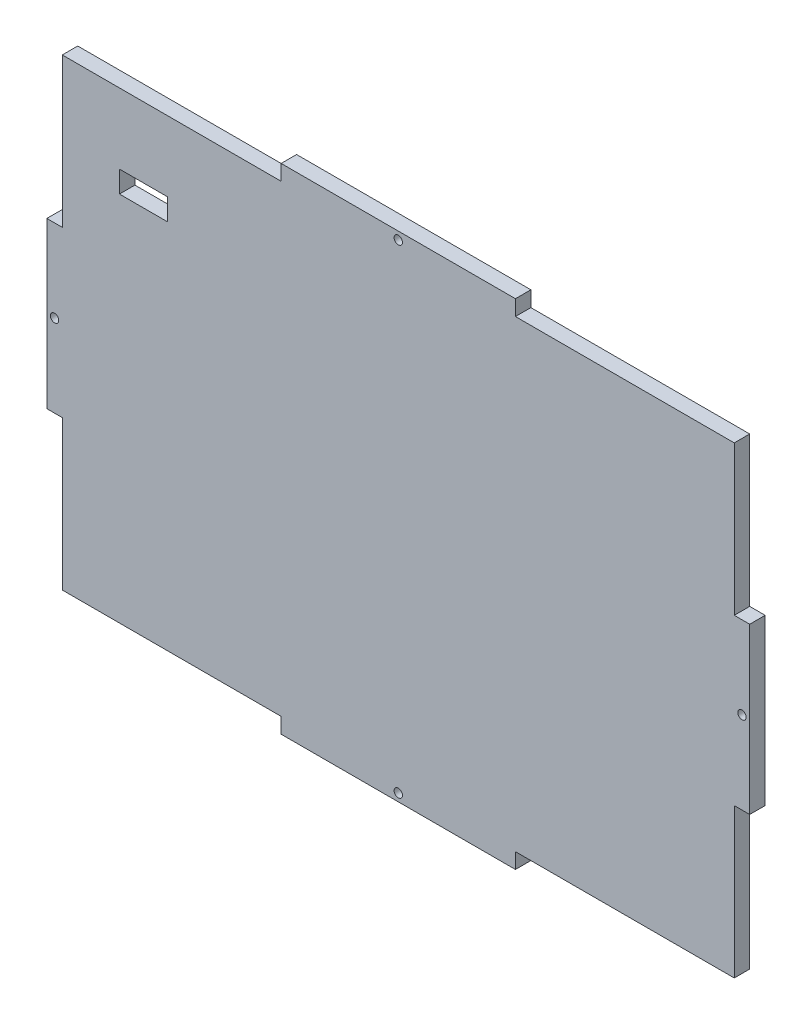
from build123d import *

# Parameters (mm, degrees)
SKETCH1_W           = 231.14
SKETCH1_H           = 162.56
BOSS_EXTRUDE1_DEPTH = 5.08
SKETCH2_R           = 1.37795
CUT_EXTRUDE1_DEPTH  = 142.381291902
CAVITY2_START       = -81.28
CAVITY2_OUTLINE_W   = 77.046666667
CAVITY2_OUTLINE_H   = 5.08
CAVITY2_DEPTH       = 5.08
CAVITY2_START_2     = 76.2
CAVITY2_2_OUTLINE_W = 77.046666667
CAVITY2_2_OUTLINE_H = 5.08
CAVITY2_2_DEPTH     = 5.08
CAVITY2_START_3     = -76.2
CAVITY2_3_OUTLINE_W = 5.08
CAVITY2_3_OUTLINE_H = 5.08
CAVITY2_3_DEPTH     = 49.106666667
CAVITY2_START_4     = 27.093333333
CAVITY2_4_OUTLINE_W = 5.08
CAVITY2_4_OUTLINE_H = 5.08
CAVITY2_4_DEPTH     = 49.106666667
SKETCH3_W           = 15.748
SKETCH3_H           = 7.112
CUT_EXTRUDE2_DEPTH  = 142.381291902


# Read off the part's stored shape, not the designer's step: Cavity2
with BuildPart() as part:
    # Sketch1 → Boss-Extrude1 (new body)
    with BuildSketch(Plane.XY):
        Rectangle(SKETCH1_W, SKETCH1_H)
    extrude(amount=BOSS_EXTRUDE1_DEPTH)

    # Sketch2 → Cut-Extrude1 (cut, through all)
    with BuildSketch(Plane(origin=(0, 0, 0), x_dir=(-1, 0, 0), z_dir=(0, 0, -1))):
        with Locations((-113.03, 0)):
            Circle(SKETCH2_R)
        with Locations(Location((0, 78.74, 0), (0, 0, 180))):
            Circle(SKETCH2_R)
        with Locations(Location((113.03, 0, 0), (0, 0, 180))):
            Circle(SKETCH2_R)
        with Locations((0, -78.74)):
            Circle(SKETCH2_R)
    extrude(amount=-CUT_EXTRUDE1_DEPTH, mode=Mode.SUBTRACT)

    # Cavity2 outline → Cavity2 (cut)
    with BuildSketch(Plane(origin=(0, 0, 0), x_dir=(1, 0, 0), z_dir=(0, 1, 0)).offset(CAVITY2_START)):
        with Locations((-77.046666667, -2.54)):
            Rectangle(CAVITY2_OUTLINE_W, CAVITY2_OUTLINE_H)
        with Locations((77.046666667, -2.54)):
            Rectangle(CAVITY2_OUTLINE_W, CAVITY2_OUTLINE_H)
    extrude(amount=CAVITY2_DEPTH, mode=Mode.SUBTRACT)

    # Cavity2 2 outline → Cavity2 2 (cut)
    with BuildSketch(Plane(origin=(0, 0, 0), x_dir=(1, 0, 0), z_dir=(0, 1, 0)).offset(CAVITY2_START_2)):
        with Locations((-77.046666667, -2.54)):
            Rectangle(CAVITY2_2_OUTLINE_W, CAVITY2_2_OUTLINE_H)
        with Locations((77.046666667, -2.54)):
            Rectangle(CAVITY2_2_OUTLINE_W, CAVITY2_2_OUTLINE_H)
    extrude(amount=CAVITY2_2_DEPTH, mode=Mode.SUBTRACT)

    # Cavity2 3 outline → Cavity2 3 (cut)
    with BuildSketch(Plane(origin=(0, 0, 0), x_dir=(1, 0, 0), z_dir=(0, 1, 0)).offset(CAVITY2_START_3)):
        with Locations((-113.03, -2.54)):
            Rectangle(CAVITY2_3_OUTLINE_W, CAVITY2_3_OUTLINE_H)
        with Locations((113.03, -2.54)):
            Rectangle(CAVITY2_3_OUTLINE_W, CAVITY2_3_OUTLINE_H)
    extrude(amount=CAVITY2_3_DEPTH, mode=Mode.SUBTRACT)

    # Cavity2 4 outline → Cavity2 4 (cut)
    with BuildSketch(Plane(origin=(0, 0, 0), x_dir=(1, 0, 0), z_dir=(0, 1, 0)).offset(CAVITY2_START_4)):
        with Locations((-113.03, -2.54)):
            Rectangle(CAVITY2_4_OUTLINE_W, CAVITY2_4_OUTLINE_H)
        with Locations((113.03, -2.54)):
            Rectangle(CAVITY2_4_OUTLINE_W, CAVITY2_4_OUTLINE_H)
    extrude(amount=CAVITY2_4_DEPTH, mode=Mode.SUBTRACT)

    # Sketch3 → Cut-Extrude2 (cut, through all)
    with BuildSketch(Plane(origin=(0, 0, 0), x_dir=(-1, 0, 0), z_dir=(0, 0, -1))):
        with Locations((83.82, 49.53)):
            Rectangle(SKETCH3_W, SKETCH3_H)
    extrude(amount=-CUT_EXTRUDE2_DEPTH, mode=Mode.SUBTRACT)


solid = part.part
